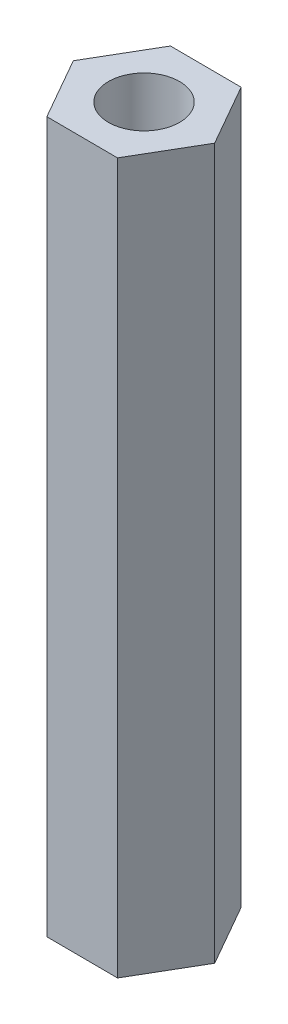
from build123d import *

# Parameters (mm, degrees)
SKETCH_1_R      = 1.5
EXTRUDE_1_DEPTH = 30


with BuildPart() as part:
    # 草图1 → 凸台-拉伸1 (new body)
    with BuildSketch(Plane(origin=(0, 0, 0), x_dir=(1, 0, 0), z_dir=(0, 1, 0))):
        Polygon((1.513237081, 2.590433779), (-1.486762919, 2.605718643), (-3, 0.015284864), (-1.513237081, -2.590433779), (1.486762919, -2.605718643), (3, -0.015284864), align=None)
        Circle(SKETCH_1_R, mode=Mode.SUBTRACT)
    extrude(amount=EXTRUDE_1_DEPTH)


solid = part.part
